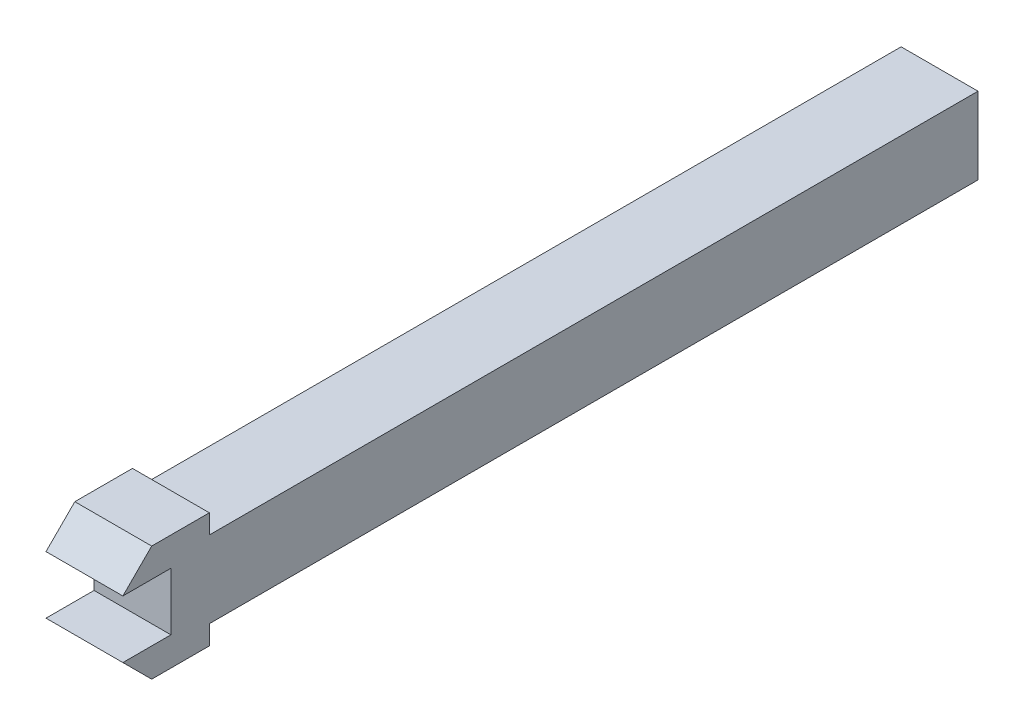
from build123d import *

# Parameters (mm, degrees)
SKETCH1_W           = 20
SKETCH1_H           = 20
BOSS_EXTRUDE1_DEPTH = 200
SKETCH2_W           = 20
SKETCH2_H           = 30
BOSS_EXTRUDE2_DEPTH = 25
SKETCH3_W           = 20
SKETCH3_H           = 15
CUT_EXTRUDE1_DEPTH  = 15
CHAMFER1_SIZE       = 10
CHAMFER3_SIZE       = 10


with BuildPart() as part:
    # Sketch1 → Boss-Extrude1 (new body)
    with BuildSketch(Plane.XY):
        Rectangle(SKETCH1_W, SKETCH1_H)
    extrude(amount=BOSS_EXTRUDE1_DEPTH)

    # Sketch2 → Boss-Extrude2 (add)
    with BuildSketch(Plane.XY.offset(200)):
        Rectangle(SKETCH2_W, SKETCH2_H)
    extrude(amount=BOSS_EXTRUDE2_DEPTH)

    # Sketch3 → Cut-Extrude1 (cut)
    with BuildSketch(Plane.XY.offset(225)):
        Rectangle(SKETCH3_W, SKETCH3_H)
    extrude(amount=-CUT_EXTRUDE1_DEPTH, mode=Mode.SUBTRACT)

    # Chamfer1
    # the kernel refuses this chamfer: 10 mm, written as the material it takes off along each edge
    with BuildSketch(Plane(origin=(35.71682988, 15, 225), x_dir=(0, -0.9996219169112968, 0.0274958766105877), z_dir=(-1, 0, 0))) as chamfer1_piece_1:
        Polygon((CHAMFER1_SIZE * 0.999621916911, -CHAMFER1_SIZE * 0.0274958766106), (-CHAMFER1_SIZE * 0.0274958766106, -CHAMFER1_SIZE * 0.999621916911), (0, 0), align=None)
    extrude(amount=71.433659759, mode=Mode.SUBTRACT)

    # Chamfer3
    # the kernel refuses this chamfer: 10 mm, written as the material it takes off along each edge
    with BuildSketch(Plane(origin=(-35.71682988, -15, 225), x_dir=(0, -0.027495876610586282, -0.9996219169112968), z_dir=(1, 0, 0))) as chamfer3_piece_1:
        Polygon((CHAMFER3_SIZE * 0.999621916911, CHAMFER3_SIZE * 0.0274958766106), (-CHAMFER3_SIZE * 0.0274958766106, CHAMFER3_SIZE * 0.999621916911), (0, 0), align=None)
    extrude(amount=71.433659759, mode=Mode.SUBTRACT)


solid = part.part
